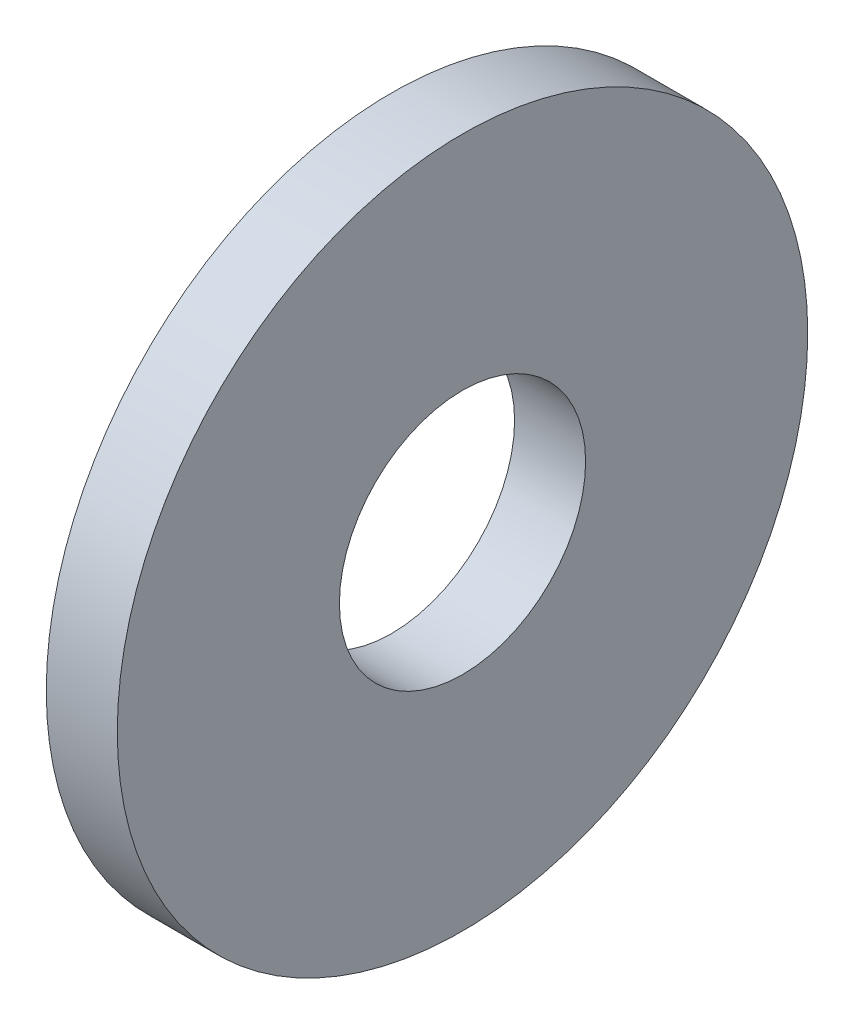
from build123d import *

# Parameters (mm, degrees)
SKETCH1_R           = 5.55625
SKETCH1_R_2         = 1.9812
BOSS_EXTRUDE1_DEPTH = 1.143


with BuildPart() as part:
    # Sketch1 → Boss-Extrude1 (new body)
    with BuildSketch(Plane(origin=(0, 0, 0), x_dir=(0, 0, -1), z_dir=(1, 0, 0))):
        Circle(SKETCH1_R)
        Circle(SKETCH1_R_2, mode=Mode.SUBTRACT)
    extrude(amount=BOSS_EXTRUDE1_DEPTH)


solid = part.part
